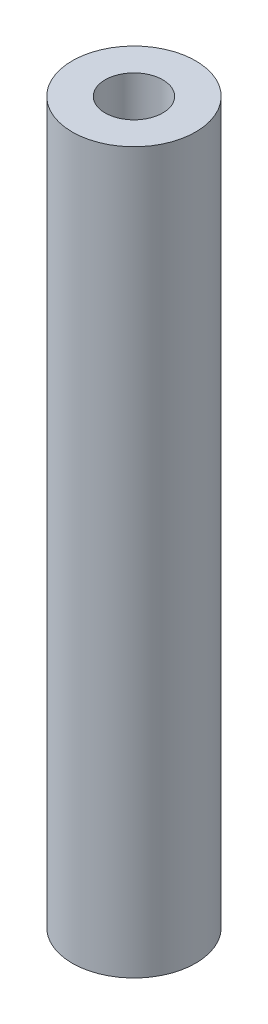
from build123d import *

# Parameters (mm, degrees)
SKETCH1_R       = 3
SKETCH1_R_2     = 1.4
EXTRUSION_DEPTH = 35


with BuildPart() as part:
    # Sketch1 → Extrusion (new body)
    with BuildSketch(Plane(origin=(0, 0, 0), x_dir=(1, 0, 0), z_dir=(0, 1, 0))):
        Circle(SKETCH1_R)
        Circle(SKETCH1_R_2, mode=Mode.SUBTRACT)
    extrude(amount=EXTRUSION_DEPTH)


solid = part.part
